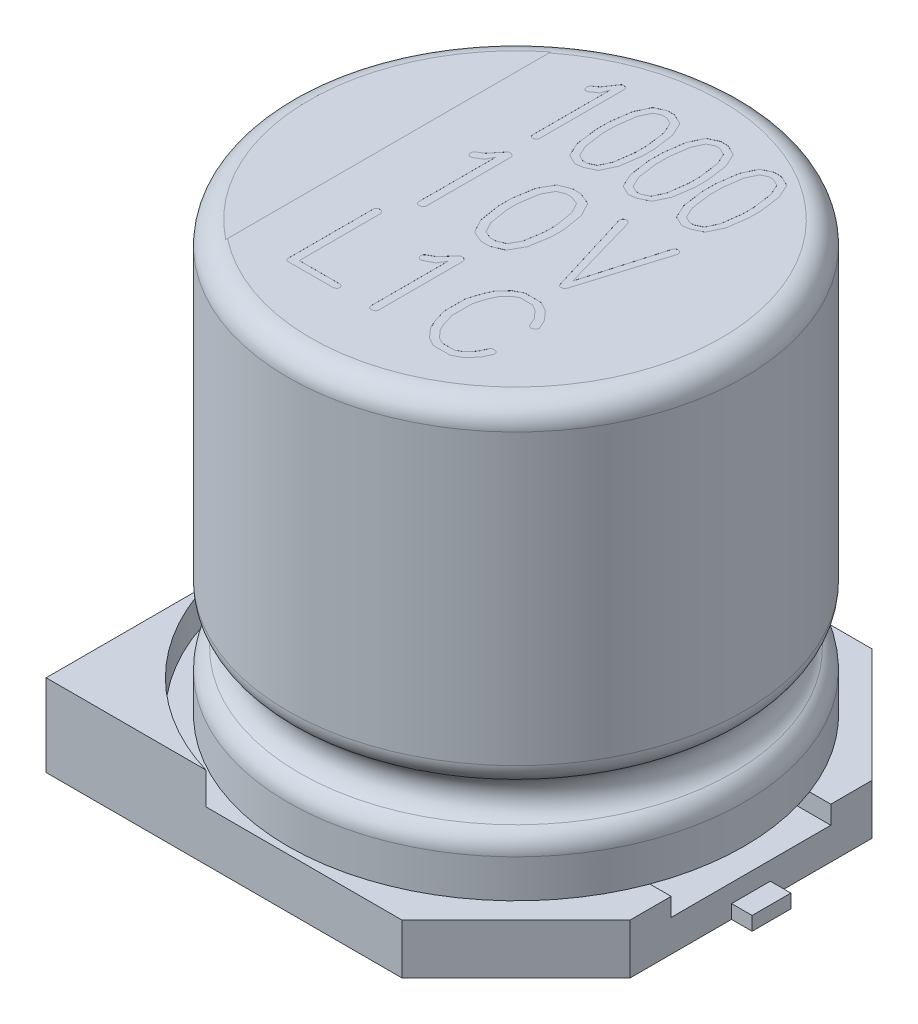
from build123d import *

# Parameters (mm, degrees)
BOSS_EXTRUDE1_DEPTH        = 1.1
BOSS_EXTRUDE2_DEPTH        = 0.7
CUT_EXTRUDE1_DEPTH         = 13.943734136
CUT_EXTRUDE1_DEPTH_BACK    = 13.943734136
SKETCH4_W                  = 3.5
SKETCH4_H                  = 0.4
BOSS_EXTRUDE3_DEPTH        = 0.001
BOSS_EXTRUDE3_DEPTH_BACK   = 0.3
SKETCH5_W                  = 3.35
SKETCH5_H                  = 0.85
BOSS_EXTRUDE3_2_DEPTH      = 0.001
BOSS_EXTRUDE3_2_DEPTH_BACK = 0.3
CUT_EXTRUDE2_DEPTH         = 13.967401474
CUT_EXTRUDE2_DEPTH_BACK    = 0.001
CUT_EXTRUDE3_START         = -0.001
CUT_EXTRUDE3_DEPTH         = 0.001


with BuildPart() as part:
    # Sketch1 → Revolve1 (revolve)
    with BuildSketch(Plane(origin=(0, 0, 0), x_dir=(0, 0, -1), z_dir=(1, 0, 0)), mode=Mode.PRIVATE) as revolve1_sk:
        with BuildLine():
            Line((0, 4.590029326), (5, 4.590029326))
            Line((5, 4.590029326), (5, -2.243945271))
            ThreePointArc((5, -2.243945271), (4.933012702, -2.493945271), (4.75, -2.676957973))
            ThreePointArc((4.75, -2.676957973), (4.5, -3.109970674), (4.75, -3.542983376))
            ThreePointArc((4.75, -3.542983376), (4.933012702, -3.725996078), (5, -3.975996078))
            Line((5, -3.975996078), (5, -4.809970674))
            Line((5, -4.809970674), (0, -4.809970674))
            Line((0, -4.809970674), (0, 4.590029326))
        make_face()
    revolve(revolve1_sk.sketch.rotate(Axis((0, 6.950146628, 0), (0, -1, 0)), 180), axis=Axis((0, 6.950146628, 0), (0, -1, 0)))

    # Sketch2 → Boss-Extrude1 (add)
    with BuildSketch(Plane.XZ.offset(4.809970674)):
        Polygon((2.65, 5.15), (5.15, 2.65), (5.15, -2.65), (2.65, -5.15), (-5.15, -5.15), (-5.15, 5.15), align=None)
    extrude(amount=BOSS_EXTRUDE1_DEPTH)

    # Sketch3 → Boss-Extrude2 (add)
    with BuildSketch(Plane(origin=(0, -4.809970674, 0), x_dir=(1, 0, 0), z_dir=(0, 1, 0))):
        with BuildLine():
            Line((-5.15, -5.15), (-1.65, -5.15))
            ThreePointArc((-1.65, -5.15), (-3.843149455, -3.843149455), (-5.15, -1.65))
            Line((-5.15, -1.65), (-5.15, -5.15))
        make_face()
        with BuildLine():
            Line((-5.15, 5.15), (-5.15, 1.65))
            ThreePointArc((-5.15, 1.65), (-3.843149455, 3.843149455), (-1.65, 5.15))
            Line((-1.65, 5.15), (-5.15, 5.15))
        make_face()
    extrude(amount=BOSS_EXTRUDE2_DEPTH)

    # Sketch4 → Cut-Extrude1 (cut, two sides: drawn at the far end of the back side and taken through both)
    with BuildSketch(Plane(origin=(5.15, 0, 0), x_dir=(0, 0, -1), z_dir=(1, 0, 0)).offset(-CUT_EXTRUDE1_DEPTH_BACK)):
        with Locations((0, -5.009970674)):
            Rectangle(SKETCH4_W, SKETCH4_H)
    extrude(amount=CUT_EXTRUDE1_DEPTH + CUT_EXTRUDE1_DEPTH_BACK, mode=Mode.SUBTRACT)

    # Sketch7 → Cut-Extrude2 (cut, two sides: drawn at the far end of the back side and taken through both)
    # profile 1 of 10: a face of its own
    with BuildSketch(Plane(origin=(0, 4.590029326, 0), x_dir=(1, 0, 0), z_dir=(0, 1, 0)).offset(-CUT_EXTRUDE2_DEPTH_BACK)):
        with BuildLine():
            Line((-1.287358611, 3.680722892), (-1.280204997, 3.653614458))
            Line((-1.280204997, 3.653614458), (-1.280581503, 1.788403614))
            add(Edge.make_bspline(
                [(-1.280581503, 1.788403614), (-1.282083709, 1.78059838), (-1.285026803, 1.765306502), (-1.300804669, 1.746576471), (-1.323002072, 1.732417863), (-1.341093541, 1.728206754), (-1.35098813, 1.725903614)],
                knots=[0, 0, 0, 0, 0.926923706, 1.816012601, 2.805533324, 4, 4, 4, 4], degree=3))
            add(Edge.make_bspline(
                [(-1.35098813, 1.725903614), (-1.359723833, 1.72627392), (-1.375804079, 1.72695556), (-1.397470416, 1.735232569), (-1.413162629, 1.75031976), (-1.418098667, 1.763278433), (-1.420641744, 1.769954819)],
                knots=[0, 0, 0, 0, 1.170207105, 2.154058829, 3.048959964, 4, 4, 4, 4], degree=3))
            Line((-1.420641744, 1.769954819), (-1.42478331, 1.786521084))
            Line((-1.42478331, 1.786521084), (-1.42478331, 3.485316265))
            Line((-1.42478331, 3.485316265), (-1.48540078, 3.319277108))
            Line((-1.48540078, 3.319277108), (-1.637509214, 3.214231928))
            add(Edge.make_bspline(
                [(-1.637509214, 3.214231928), (-1.643383153, 3.212719292), (-1.655400882, 3.209624528), (-1.667728225, 3.208188802), (-1.674030298, 3.207454819)],
                knots=[0, 0, 0, 0, 0.977545561, 2, 2, 2, 2], degree=3))
            add(Edge.make_bspline(
                [(-1.674030298, 3.207454819), (-1.678471766, 3.207710325), (-1.687104273, 3.20820693), (-1.699338984, 3.21318995), (-1.71043867, 3.220857322), (-1.723412192, 3.235214884), (-1.735972443, 3.258569338), (-1.737330004, 3.279679412), (-1.738036322, 3.290662651)],
                knots=[0, 0, 0, 0, 0.684472364, 1.330351367, 2.014823731, 2.757238248, 4.312842215, 6, 6, 6, 6], degree=3))
            add(Edge.make_bspline(
                [(-1.738036322, 3.290662651), (-1.737896608, 3.295067066), (-1.737627815, 3.303540598), (-1.73612328, 3.311882601), (-1.73540078, 3.315888554)],
                knots=[0, 0, 0, 0, 1.039570203, 2, 2, 2, 2], degree=3))
            add(Edge.make_bspline(
                [(-1.73540078, 3.315888554), (-1.732055146, 3.324876433), (-1.72603216, 3.341056883), (-1.713490769, 3.352825719), (-1.70791584, 3.358057229)],
                knots=[0, 0, 0, 0, 1.110955416, 2, 2, 2, 2], degree=3))
            Line((-1.70791584, 3.358057229), (-1.594211021, 3.439759036))
            Line((-1.594211021, 3.439759036), (-1.411605599, 3.704066265))
            add(Edge.make_bspline(
                [(-1.411605599, 3.704066265), (-1.409112114, 3.707328687), (-1.404159295, 3.713808849), (-1.394192911, 3.721323412), (-1.381957633, 3.724899665), (-1.373470268, 3.725560341), (-1.369060419, 3.725903614)],
                knots=[0, 0, 0, 0, 0.984513404, 1.95554287, 2.937744663, 4, 4, 4, 4], degree=3))
            add(Edge.make_bspline(
                [(-1.369060419, 3.725903614), (-1.361062154, 3.72547855), (-1.345191019, 3.724635084), (-1.322994282, 3.715329488), (-1.302817886, 3.701003687), (-1.292677955, 3.68770126), (-1.287358611, 3.680722892)],
                knots=[0, 0, 0, 0, 0.981550807, 1.947712958, 2.923383228, 4, 4, 4, 4], degree=3))
        make_face()
    # profile 2 of 10: a face of its own
    with BuildSketch(Plane(origin=(0, 4.590029326, 0), x_dir=(1, 0, 0), z_dir=(0, 1, 0)).offset(-CUT_EXTRUDE2_DEPTH_BACK)):
        with BuildLine():
            add(Edge.make_bspline(
                [(-0.248051383, 3.72251506), (-0.24203034, 3.719496974), (-0.229135091, 3.713033147), (-0.208595148, 3.702902732), (-0.18527564, 3.691944253), (-0.159558959, 3.679621723), (-0.131158222, 3.665881803), (-0.100055538, 3.651416772), (-0.066480613, 3.635477098), (-0.043237923, 3.624611149), (-0.031183913, 3.618975904)],
                knots=[0, 0, 0, 0, 0.672609136, 1.440525024, 2.287058542, 3.245674053, 4.288353812, 5.437736142, 6.671171322, 8, 8, 8, 8], degree=3))
            Line((-0.031183913, 3.618975904), (-0.011982105, 3.59186747))
            Line((-0.011982105, 3.59186747), (0.111888377, 3.325301205))
            Line((0.111888377, 3.325301205), (0.118288979, 3.301204819))
            Line((0.118288979, 3.301204819), (0.180035967, 2.854292169))
            Line((0.180035967, 2.854292169), (0.180035967, 2.583960843))
            Line((0.180035967, 2.583960843), (0.116406449, 2.130271084))
            Line((0.116406449, 2.130271084), (0.111135364, 2.123493976))
            Line((0.111135364, 2.123493976), (-0.02478331, 1.839608434))
            Line((-0.02478331, 1.839608434), (-0.036831503, 1.827560241))
            add(Edge.make_bspline(
                [(-0.036831503, 1.827560241), (-0.044261402, 1.82460761), (-0.060515075, 1.818148424), (-0.086099536, 1.806375553), (-0.11527551, 1.792820958), (-0.146245318, 1.777689353), (-0.176463601, 1.762188932), (-0.20401506, 1.749408073), (-0.226578799, 1.737927848), (-0.240141144, 1.731167327), (-0.246168852, 1.728162651)],
                knots=[0, 0, 0, 0, 0.827651576, 1.81057338, 2.915068925, 4.158703476, 5.379039228, 6.43099689, 7.302665284, 8, 8, 8, 8], degree=3))
            Line((-0.246168852, 1.728162651), (-0.412961021, 1.701807229))
            add(Edge.make_bspline(
                [(-0.412961021, 1.701807229), (-0.426549241, 1.70775713), (-0.456286547, 1.720778263), (-0.504097963, 1.74380585), (-0.559791458, 1.770206799), (-0.599121465, 1.789950838), (-0.620039334, 1.800451807)],
                knots=[0, 0, 0, 0, 0.775902592, 1.698033599, 2.775687197, 4, 4, 4, 4], degree=3))
            Line((-0.620039334, 1.800451807), (-0.63848813, 1.822665663))
            Line((-0.63848813, 1.822665663), (-0.765747166, 2.102033133))
            Line((-0.765747166, 2.102033133), (-0.770641744, 2.122364458))
            Line((-0.770641744, 2.122364458), (-0.832012226, 2.574171687))
            Line((-0.832012226, 2.574171687), (-0.832012226, 2.864457831))
            Line((-0.832012226, 2.864457831), (-0.770265238, 3.315135542))
            Line((-0.770265238, 3.315135542), (-0.764241142, 3.333207831))
            Line((-0.764241142, 3.333207831), (-0.634346563, 3.607304217))
            Line((-0.634346563, 3.607304217), (-0.617403792, 3.627635542))
            add(Edge.make_bspline(
                [(-0.617403792, 3.627635542), (-0.610497497, 3.630513019), (-0.595392183, 3.636806582), (-0.570938493, 3.647242334), (-0.543026252, 3.660221362), (-0.512637146, 3.674620918), (-0.482230621, 3.689753482), (-0.453839522, 3.702988578), (-0.429046657, 3.71490436), (-0.413717575, 3.722145988), (-0.406560419, 3.725527108)],
                knots=[0, 0, 0, 0, 0.772324666, 1.689213553, 2.744240256, 3.949553191, 5.160492455, 6.249955038, 7.182903063, 8, 8, 8, 8], degree=3))
            Line((-0.406560419, 3.725527108), (-0.248051383, 3.72251506))
        make_face()
        Polygon((-0.133593551, 3.510542169), (-0.283066443, 3.581325301), (-0.382840539, 3.581325301), (-0.520641744, 3.515060241), (-0.629075479, 3.282379518), (-0.687433913, 2.857680723), (-0.687433913, 2.581325301), (-0.627569455, 2.149849398), (-0.518006202, 1.912274096), (-0.383217045, 1.846385542), (-0.284948973, 1.846385542), (-0.131711021, 1.921686747), (-0.022524274, 2.155873494), (0.035457654, 2.580948795), (0.035457654, 2.835090361), (-0.02478331, 3.27560241), align=None, mode=Mode.SUBTRACT)
    # profile 3 of 10: a face of its own
    with BuildSketch(Plane(origin=(0, 4.590029326, 0), x_dir=(1, 0, 0), z_dir=(0, 1, 0)).offset(-CUT_EXTRUDE2_DEPTH_BACK)):
        with BuildLine():
            add(Edge.make_bspline(
                [(0.923032955, 3.72251506), (0.929053997, 3.719496974), (0.941949246, 3.713033147), (0.962489189, 3.702902732), (0.985808697, 3.691944253), (1.011525379, 3.679621723), (1.039926115, 3.665881803), (1.071028799, 3.651416772), (1.104603724, 3.635477098), (1.127846415, 3.624611149), (1.139900425, 3.618975904)],
                knots=[0, 0, 0, 0, 0.672609136, 1.440525024, 2.287058542, 3.245674053, 4.288353812, 5.437736142, 6.671171322, 8, 8, 8, 8], degree=3))
            Line((1.139900425, 3.618975904), (1.159102232, 3.59186747))
            Line((1.159102232, 3.59186747), (1.282972714, 3.325301205))
            Line((1.282972714, 3.325301205), (1.289373316, 3.301204819))
            Line((1.289373316, 3.301204819), (1.351120304, 2.854292169))
            Line((1.351120304, 2.854292169), (1.351120304, 2.583960843))
            Line((1.351120304, 2.583960843), (1.287490786, 2.130271084))
            Line((1.287490786, 2.130271084), (1.282219702, 2.123493976))
            Line((1.282219702, 2.123493976), (1.146301027, 1.839608434))
            Line((1.146301027, 1.839608434), (1.134252834, 1.827560241))
            add(Edge.make_bspline(
                [(1.134252834, 1.827560241), (1.126822935, 1.82460761), (1.110569262, 1.818148424), (1.084984801, 1.806375553), (1.055808827, 1.792820958), (1.024839019, 1.777689353), (0.994620736, 1.762188932), (0.967069278, 1.749408073), (0.944505539, 1.737927848), (0.930943194, 1.731167327), (0.924915485, 1.728162651)],
                knots=[0, 0, 0, 0, 0.827651576, 1.81057338, 2.915068925, 4.158703476, 5.379039228, 6.43099689, 7.302665284, 8, 8, 8, 8], degree=3))
            Line((0.924915485, 1.728162651), (0.758123316, 1.701807229))
            add(Edge.make_bspline(
                [(0.758123316, 1.701807229), (0.744535097, 1.70775713), (0.71479779, 1.720778263), (0.666986374, 1.74380585), (0.61129288, 1.770206799), (0.571962872, 1.789950838), (0.551045003, 1.800451807)],
                knots=[0, 0, 0, 0, 0.775902592, 1.698033599, 2.775687197, 4, 4, 4, 4], degree=3))
            Line((0.551045003, 1.800451807), (0.532596208, 1.822665663))
            Line((0.532596208, 1.822665663), (0.405337172, 2.102033133))
            Line((0.405337172, 2.102033133), (0.400442593, 2.122364458))
            Line((0.400442593, 2.122364458), (0.339072111, 2.574171687))
            Line((0.339072111, 2.574171687), (0.339072111, 2.864457831))
            Line((0.339072111, 2.864457831), (0.400819099, 3.315135542))
            Line((0.400819099, 3.315135542), (0.406843196, 3.333207831))
            Line((0.406843196, 3.333207831), (0.536737774, 3.607304217))
            Line((0.536737774, 3.607304217), (0.553680545, 3.627635542))
            add(Edge.make_bspline(
                [(0.553680545, 3.627635542), (0.56058684, 3.630513019), (0.575692155, 3.636806582), (0.600145845, 3.647242334), (0.628058085, 3.660221362), (0.658447191, 3.674620918), (0.688853716, 3.689753482), (0.717244816, 3.702988578), (0.74203768, 3.71490436), (0.757366762, 3.722145988), (0.764523919, 3.725527108)],
                knots=[0, 0, 0, 0, 0.772324666, 1.689213553, 2.744240256, 3.949553191, 5.160492455, 6.249955038, 7.182903063, 8, 8, 8, 8], degree=3))
            Line((0.764523919, 3.725527108), (0.923032955, 3.72251506))
        make_face()
        Polygon((1.037490786, 3.510542169), (0.888017895, 3.581325301), (0.788243798, 3.581325301), (0.650442593, 3.515060241), (0.542008858, 3.282379518), (0.483650425, 2.857680723), (0.483650425, 2.581325301), (0.543514883, 2.149849398), (0.653078136, 1.912274096), (0.787867292, 1.846385542), (0.886135364, 1.846385542), (1.039373316, 1.921686747), (1.148560063, 2.155873494), (1.206541991, 2.580948795), (1.206541991, 2.835090361), (1.146301027, 3.27560241), align=None, mode=Mode.SUBTRACT)
    # profile 4 of 10: a face of its own
    with BuildSketch(Plane(origin=(0, 4.590029326, 0), x_dir=(1, 0, 0), z_dir=(0, 1, 0)).offset(-CUT_EXTRUDE2_DEPTH_BACK)):
        with BuildLine():
            add(Edge.make_bspline(
                [(2.094117292, 3.72251506), (2.100138335, 3.719496974), (2.113033584, 3.713033147), (2.133573526, 3.702902732), (2.156893035, 3.691944253), (2.182609716, 3.679621723), (2.211010453, 3.665881803), (2.242113136, 3.651416772), (2.275688062, 3.635477098), (2.298930752, 3.624611149), (2.310984762, 3.618975904)],
                knots=[0, 0, 0, 0, 0.672609136, 1.440525024, 2.287058542, 3.245674053, 4.288353812, 5.437736142, 6.671171322, 8, 8, 8, 8], degree=3))
            Line((2.310984762, 3.618975904), (2.330186569, 3.59186747))
            Line((2.330186569, 3.59186747), (2.454057051, 3.325301205))
            Line((2.454057051, 3.325301205), (2.460457654, 3.301204819))
            Line((2.460457654, 3.301204819), (2.522204642, 2.854292169))
            Line((2.522204642, 2.854292169), (2.522204642, 2.583960843))
            Line((2.522204642, 2.583960843), (2.458575123, 2.130271084))
            Line((2.458575123, 2.130271084), (2.453304039, 2.123493976))
            Line((2.453304039, 2.123493976), (2.317385364, 1.839608434))
            Line((2.317385364, 1.839608434), (2.305337172, 1.827560241))
            add(Edge.make_bspline(
                [(2.305337172, 1.827560241), (2.297907272, 1.82460761), (2.2816536, 1.818148424), (2.256069139, 1.806375553), (2.226893164, 1.792820958), (2.195923357, 1.777689353), (2.165705073, 1.762188932), (2.138153615, 1.749408073), (2.115589876, 1.737927848), (2.102027531, 1.731167327), (2.095999822, 1.728162651)],
                knots=[0, 0, 0, 0, 0.827651576, 1.81057338, 2.915068925, 4.158703476, 5.379039228, 6.43099689, 7.302665284, 8, 8, 8, 8], degree=3))
            Line((2.095999822, 1.728162651), (1.929207654, 1.701807229))
            add(Edge.make_bspline(
                [(1.929207654, 1.701807229), (1.915619434, 1.70775713), (1.885882128, 1.720778263), (1.838070711, 1.74380585), (1.782377217, 1.770206799), (1.743047209, 1.789950838), (1.72212934, 1.800451807)],
                knots=[0, 0, 0, 0, 0.775902592, 1.698033599, 2.775687197, 4, 4, 4, 4], degree=3))
            Line((1.72212934, 1.800451807), (1.703680545, 1.822665663))
            Line((1.703680545, 1.822665663), (1.576421509, 2.102033133))
            Line((1.576421509, 2.102033133), (1.571526931, 2.122364458))
            Line((1.571526931, 2.122364458), (1.510156449, 2.574171687))
            Line((1.510156449, 2.574171687), (1.510156449, 2.864457831))
            Line((1.510156449, 2.864457831), (1.571903437, 3.315135542))
            Line((1.571903437, 3.315135542), (1.577927533, 3.333207831))
            Line((1.577927533, 3.333207831), (1.707822111, 3.607304217))
            Line((1.707822111, 3.607304217), (1.724764883, 3.627635542))
            add(Edge.make_bspline(
                [(1.724764883, 3.627635542), (1.731671177, 3.630513019), (1.746776492, 3.636806582), (1.771230182, 3.647242334), (1.799142422, 3.660221362), (1.829531529, 3.674620918), (1.859938054, 3.689753482), (1.888329153, 3.702988578), (1.913122017, 3.71490436), (1.928451099, 3.722145988), (1.935608256, 3.725527108)],
                knots=[0, 0, 0, 0, 0.772324666, 1.689213553, 2.744240256, 3.949553191, 5.160492455, 6.249955038, 7.182903063, 8, 8, 8, 8], degree=3))
            Line((1.935608256, 3.725527108), (2.094117292, 3.72251506))
        make_face()
        Polygon((2.208575123, 3.510542169), (2.059102232, 3.581325301), (1.959328136, 3.581325301), (1.821526931, 3.515060241), (1.713093196, 3.282379518), (1.654734762, 2.857680723), (1.654734762, 2.581325301), (1.71459922, 2.149849398), (1.824162473, 1.912274096), (1.95895163, 1.846385542), (2.057219702, 1.846385542), (2.210457654, 1.921686747), (2.319644401, 2.155873494), (2.377626328, 2.580948795), (2.377626328, 2.835090361), (2.317385364, 3.27560241), align=None, mode=Mode.SUBTRACT)
    # profile 5 of 10: a face of its own
    with BuildSketch(Plane(origin=(0, 4.590029326, 0), x_dir=(1, 0, 0), z_dir=(0, 1, 0)).offset(-CUT_EXTRUDE2_DEPTH_BACK)):
        with BuildLine():
            Line((-1.245104775, 1.156622024), (-1.238036322, 1.133556548))
            Line((-1.238036322, 1.133556548), (-1.238408346, -0.735863095))
            add(Edge.make_bspline(
                [(-1.238408346, -0.735863095), (-1.240232416, -0.743863942), (-1.243842331, -0.759697981), (-1.261642445, -0.778827002), (-1.286949888, -0.791795773), (-1.306816525, -0.795564198), (-1.317649418, -0.797619048)],
                knots=[0, 0, 0, 0, 0.894623444, 1.770500318, 2.784296937, 4, 4, 4, 4], degree=3))
            add(Edge.make_bspline(
                [(-1.317649418, -0.797619048), (-1.327759081, -0.797233266), (-1.346126371, -0.796532375), (-1.3708586, -0.788890132), (-1.38959564, -0.774993641), (-1.395974132, -0.761996098), (-1.399122632, -0.755580357)],
                knots=[0, 0, 0, 0, 1.236245911, 2.246018165, 3.134213831, 4, 4, 4, 4], degree=3))
            Line((-1.399122632, -0.755580357), (-1.404702989, -0.738467262))
            Line((-1.404702989, -0.738467262), (-1.404702989, 0.964657738))
            Line((-1.404702989, 0.964657738), (-1.485432156, 0.799479167))
            Line((-1.485432156, 0.799479167), (-1.657307156, 0.696056548))
            add(Edge.make_bspline(
                [(-1.657307156, 0.696056548), (-1.662874288, 0.694862614), (-1.674566155, 0.692355164), (-1.686433014, 0.690877982), (-1.692649418, 0.690104167)],
                knots=[0, 0, 0, 0, 0.952308529, 2, 2, 2, 2], degree=3))
            add(Edge.make_bspline(
                [(-1.692649418, 0.690104167), (-1.697156576, 0.690377075), (-1.706150233, 0.690921642), (-1.718998937, 0.695784149), (-1.731154164, 0.702858803), (-1.741942648, 0.713022949), (-1.75067414, 0.725493229), (-1.757134298, 0.739746203), (-1.761457526, 0.75545157), (-1.761713847, 0.766586967), (-1.761845846, 0.772321429)],
                knots=[0, 0, 0, 0, 0.902813073, 1.801487944, 2.72907741, 3.716676652, 4.753977817, 5.768877659, 6.851025504, 8, 8, 8, 8], degree=3))
            add(Edge.make_bspline(
                [(-1.761845846, 0.772321429), (-1.761577746, 0.776799185), (-1.761053416, 0.785556446), (-1.759336604, 0.79415913), (-1.758497632, 0.798363095)],
                knots=[0, 0, 0, 0, 1.022638749, 2, 2, 2, 2], degree=3))
            add(Edge.make_bspline(
                [(-1.758497632, 0.798363095), (-1.754441279, 0.807314482), (-1.746994176, 0.823748432), (-1.732914308, 0.834935956), (-1.726503584, 0.840029762)],
                knots=[0, 0, 0, 0, 1.08937731, 2, 2, 2, 2], degree=3))
            Line((-1.726503584, 0.840029762), (-1.59331906, 0.920386905))
            Line((-1.59331906, 0.920386905), (-1.378289298, 1.18266369))
            add(Edge.make_bspline(
                [(-1.378289298, 1.18266369), (-1.375434427, 1.185658576), (-1.369766324, 1.191604663), (-1.359055454, 1.198026477), (-1.346805765, 1.201900297), (-1.338140648, 1.202216798), (-1.333646441, 1.202380952)],
                knots=[0, 0, 0, 0, 0.98022139, 1.946145258, 2.934757973, 4, 4, 4, 4], degree=3))
            add(Edge.make_bspline(
                [(-1.333646441, 1.202380952), (-1.325382866, 1.201794041), (-1.308899768, 1.200623348), (-1.285332721, 1.191513759), (-1.26338431, 1.176982187), (-1.251396361, 1.163629736), (-1.245104775, 1.156622024)],
                knots=[0, 0, 0, 0, 0.960804293, 1.916486586, 2.906518233, 4, 4, 4, 4], degree=3))
        make_face()
    # profile 6 of 10: a face of its own
    with BuildSketch(Plane(origin=(0, 4.590029326, 0), x_dir=(1, 0, 0), z_dir=(0, 1, 0)).offset(-CUT_EXTRUDE2_DEPTH_BACK)):
        with BuildLine():
            add(Edge.make_bspline(
                [(0.221189868, 1.199032738), (0.228000269, 1.196033053), (0.242694002, 1.189561102), (0.266358948, 1.179759639), (0.292838885, 1.168282376), (0.322618622, 1.156777975), (0.354965164, 1.143158677), (0.390331457, 1.128522429), (0.429010864, 1.113612528), (0.455584682, 1.102728091), (0.469329749, 1.097098214)],
                knots=[0, 0, 0, 0, 0.665720275, 1.436320058, 2.291406459, 3.247277281, 4.291804095, 5.431067394, 6.671242782, 8, 8, 8, 8], degree=3))
            Line((0.469329749, 1.097098214), (0.493511297, 1.068080357))
            Line((0.493511297, 1.068080357), (0.636740463, 0.802827381))
            Line((0.636740463, 0.802827381), (0.644924987, 0.774925595))
            Line((0.644924987, 0.774925595), (0.716725582, 0.333333333))
            Line((0.716725582, 0.333333333), (0.716725582, 0.058407738))
            Line((0.716725582, 0.058407738), (0.642320821, -0.393973214))
            Line((0.642320821, -0.393973214), (0.63636844, -0.402157738))
            Line((0.63636844, -0.402157738), (0.477886297, -0.685267857))
            Line((0.477886297, -0.685267857), (0.463377368, -0.697544643))
            add(Edge.make_bspline(
                [(0.463377368, -0.697544643), (0.454421412, -0.700569997), (0.43538385, -0.707000955), (0.405549375, -0.718901145), (0.372130739, -0.732141295), (0.336721639, -0.746920367), (0.301729832, -0.761627978), (0.270107045, -0.775432928), (0.242665453, -0.786843473), (0.226136817, -0.794239959), (0.218585702, -0.797619048)],
                knots=[0, 0, 0, 0, 0.857514317, 1.822807192, 2.913398912, 4.118988428, 5.303819582, 6.357154914, 7.249465436, 8, 8, 8, 8], degree=3))
            Line((0.218585702, -0.797619048), (0.031829749, -0.797619048))
            add(Edge.make_bspline(
                [(0.031829749, -0.797619048), (0.016792704, -0.791870623), (-0.016422532, -0.779172963), (-0.070313291, -0.756349969), (-0.133885042, -0.730302769), (-0.179137427, -0.7108846), (-0.203289298, -0.700520833)],
                knots=[0, 0, 0, 0, 0.759314602, 1.677245352, 2.760311232, 4, 4, 4, 4], degree=3))
            Line((-0.203289298, -0.700520833), (-0.224122632, -0.679315476))
            Line((-0.224122632, -0.679315476), (-0.372560132, -0.40327381))
            Line((-0.372560132, -0.40327381), (-0.378140489, -0.3828125))
            Line((-0.378140489, -0.3828125), (-0.449941084, 0.0625))
            Line((-0.449941084, 0.0625), (-0.449941084, 0.351934524))
            Line((-0.449941084, 0.351934524), (-0.377396441, 0.797247024))
            Line((-0.377396441, 0.797247024), (-0.369955965, 0.816592262))
            Line((-0.369955965, 0.816592262), (-0.219286322, 1.087053571))
            Line((-0.219286322, 1.087053571), (-0.19956906, 1.10639881))
            add(Edge.make_bspline(
                [(-0.19956906, 1.10639881), (-0.191731681, 1.109059584), (-0.174450164, 1.114926625), (-0.146832701, 1.126108612), (-0.114190312, 1.138040132), (-0.078960225, 1.152478606), (-0.043711853, 1.16739438), (-0.010956452, 1.180010673), (0.017023607, 1.191836554), (0.034301701, 1.19880482), (0.042246416, 1.202008929)],
                knots=[0, 0, 0, 0, 0.76366452, 1.683889708, 2.748731425, 3.970665397, 5.196932387, 6.280730219, 7.209455205, 8, 8, 8, 8], degree=3))
            Line((0.042246416, 1.202008929), (0.221189868, 1.199032738))
        make_face()
        Polygon((0.358466654, 0.966889881), (0.184731535, 1.035714286), (0.066799987, 1.035714286), (-0.093914298, 0.970238095), (-0.216682156, 0.747767857), (-0.283274418, 0.338169643), (-0.283274418, 0.076636905), (-0.214450013, -0.341145833), (-0.091682156, -0.565848214), (0.066427963, -0.630952381), (0.183615463, -0.630952381), (0.360698797, -0.556919643), (0.483838678, -0.334077381), (0.550058916, 0.076636905), (0.550058916, 0.318080357), (0.481606535, 0.741071429), align=None, mode=Mode.SUBTRACT)
    # profile 7 of 10: a face of its own
    with BuildSketch(Plane(origin=(0, 4.590029326, 0), x_dir=(1, 0, 0), z_dir=(0, 1, 0)).offset(-CUT_EXTRUDE2_DEPTH_BACK)):
        with BuildLine():
            Line((1.301323797, 1.15327381), (1.789791059, -0.545386905))
            Line((1.789791059, -0.545386905), (2.282722606, 1.161458333))
            add(Edge.make_bspline(
                [(2.282722606, 1.161458333), (2.286357292, 1.166601162), (2.293560059, 1.176792578), (2.308105525, 1.188886051), (2.325305438, 1.197669065), (2.337943292, 1.200774879), (2.344478559, 1.202380952)],
                knots=[0, 0, 0, 0, 0.987716808, 1.957333834, 2.943699851, 4, 4, 4, 4], degree=3))
            add(Edge.make_bspline(
                [(2.344478559, 1.202380952), (2.354501203, 1.200237705), (2.373014436, 1.196278825), (2.397434184, 1.185924101), (2.416519124, 1.17217667), (2.424166204, 1.159880136), (2.427811892, 1.154017857)],
                knots=[0, 0, 0, 0, 1.230125372, 2.272214417, 3.17629134, 4, 4, 4, 4], degree=3))
            add(Edge.make_bspline(
                [(2.427811892, 1.154017857), (2.429218066, 1.147840087), (2.432504563, 1.133401466), (2.4330692, 1.118592046), (2.433392249, 1.110119048)],
                knots=[0, 0, 0, 0, 0.855728484, 2, 2, 2, 2], degree=3))
            Line((2.433392249, 1.110119048), (1.863079749, -0.756324405))
            add(Edge.make_bspline(
                [(1.863079749, -0.756324405), (1.859030636, -0.762786939), (1.850954926, -0.775676073), (1.830482838, -0.788686834), (1.805245766, -0.796479472), (1.786513442, -0.797219462), (1.776398202, -0.797619048)],
                knots=[0, 0, 0, 0, 0.894720018, 1.784464948, 2.803636489, 4, 4, 4, 4], degree=3))
            add(Edge.make_bspline(
                [(1.776398202, -0.797619048), (1.769306399, -0.797036003), (1.755607833, -0.795909791), (1.737319828, -0.785144837), (1.722913946, -0.768337221), (1.717769163, -0.753971963), (1.715014273, -0.746279762)],
                knots=[0, 0, 0, 0, 0.979272317, 1.891568073, 2.870992581, 4, 4, 4, 4], degree=3))
            Line((1.715014273, -0.746279762), (1.147677963, 1.104910714))
            add(Edge.make_bspline(
                [(1.147677963, 1.104910714), (1.147687028, 1.112128994), (1.147703846, 1.125522545), (1.151190596, 1.143942019), (1.154531039, 1.159997665), (1.159496762, 1.16885587), (1.161814868, 1.172991071)],
                knots=[0, 0, 0, 0, 1.227509019, 2.277648804, 3.195969407, 4, 4, 4, 4], degree=3))
            add(Edge.make_bspline(
                [(1.161814868, 1.172991071), (1.166508009, 1.17751346), (1.175150933, 1.185841925), (1.189332046, 1.194934438), (1.202743118, 1.201128691), (1.211859897, 1.201981488), (1.216130344, 1.202380952)],
                knots=[0, 0, 0, 0, 1.233937754, 2.272428876, 3.190777528, 4, 4, 4, 4], degree=3))
            add(Edge.make_bspline(
                [(1.216130344, 1.202380952), (1.224077092, 1.201602469), (1.24122079, 1.19992303), (1.264680767, 1.187440745), (1.286857888, 1.173300402), (1.296794078, 1.159544748), (1.301323797, 1.15327381)],
                knots=[0, 0, 0, 0, 0.933686637, 2.014263215, 3.094740652, 4, 4, 4, 4], degree=3))
        make_face()
    # profile 8 of 10: a face of its own
    with BuildSketch(Plane(origin=(0, 4.590029326, 0), x_dir=(1, 0, 0), z_dir=(0, 1, 0)).offset(-CUT_EXTRUDE2_DEPTH_BACK)):
        with BuildLine():
            Line((-1.597783346, -1.353050595), (-1.595179179, -1.37202381))
            Line((-1.595179179, -1.37202381), (-1.595179179, -3.154761905))
            Line((-1.595179179, -3.154761905), (-0.71831906, -3.155133929))
            add(Edge.make_bspline(
                [(-0.71831906, -3.155133929), (-0.706997395, -3.157035279), (-0.686284086, -3.160513853), (-0.65973083, -3.173431937), (-0.64112137, -3.193064898), (-0.637049439, -3.209370181), (-0.634985727, -3.217633929)],
                knots=[0, 0, 0, 0, 1.220300133, 2.232573956, 3.104243569, 4, 4, 4, 4], degree=3))
            add(Edge.make_bspline(
                [(-0.634985727, -3.217633929), (-0.63560318, -3.225318569), (-0.636811784, -3.240360515), (-0.647411816, -3.261226215), (-0.664539351, -3.278785037), (-0.679244063, -3.287192631), (-0.68706906, -3.291666667)],
                knots=[0, 0, 0, 0, 0.960624189, 1.880329837, 2.8720341, 4, 4, 4, 4], degree=3))
            Line((-0.68706906, -3.291666667), (-0.712738703, -3.297619048))
            Line((-0.712738703, -3.297619048), (-1.707902394, -3.297619048))
            add(Edge.make_bspline(
                [(-1.707902394, -3.297619048), (-1.715098808, -3.295235837), (-1.729038517, -3.290619474), (-1.745582071, -3.275876065), (-1.757520911, -3.256792382), (-1.760353092, -3.241868754), (-1.761845846, -3.234002976)],
                knots=[0, 0, 0, 0, 1.014260557, 1.964658675, 2.927235296, 4, 4, 4, 4], degree=3))
            Line((-1.761845846, -3.234002976), (-1.761845846, -1.354910714))
            add(Edge.make_bspline(
                [(-1.761845846, -1.354910714), (-1.759259558, -1.347410478), (-1.754326272, -1.333103947), (-1.740941571, -1.315187299), (-1.722755878, -1.302929439), (-1.708810879, -1.299432707), (-1.701577989, -1.297619048)],
                knots=[0, 0, 0, 0, 1.076188992, 2.052805991, 2.990043777, 4, 4, 4, 4], degree=3))
            add(Edge.make_bspline(
                [(-1.701577989, -1.297619048), (-1.690319729, -1.29814989), (-1.668863201, -1.299161595), (-1.639170818, -1.309919448), (-1.614445276, -1.327935812), (-1.603401743, -1.344581899), (-1.597783346, -1.353050595)],
                knots=[0, 0, 0, 0, 1.088492209, 2.07450024, 3.020402102, 4, 4, 4, 4], degree=3))
        make_face()
    # profile 9 of 10: a face of its own
    with BuildSketch(Plane(origin=(0, 4.590029326, 0), x_dir=(1, 0, 0), z_dir=(0, 1, 0)).offset(-CUT_EXTRUDE2_DEPTH_BACK)):
        with BuildLine():
            Line((0.205416059, -1.34077381), (0.21434463, -1.367559524))
            Line((0.21434463, -1.367559524), (0.213972606, -3.235863095))
            add(Edge.make_bspline(
                [(0.213972606, -3.235863095), (0.212148537, -3.243863942), (0.208538621, -3.259697981), (0.190738507, -3.278827002), (0.165431064, -3.291795773), (0.145564428, -3.295564198), (0.134731535, -3.297619048)],
                knots=[0, 0, 0, 0, 0.894623444, 1.770500318, 2.784296937, 4, 4, 4, 4], degree=3))
            add(Edge.make_bspline(
                [(0.134731535, -3.297619048), (0.124621872, -3.297233266), (0.106254581, -3.296532375), (0.081522352, -3.288890132), (0.062785313, -3.274993641), (0.05640682, -3.261996098), (0.053258321, -3.255580357)],
                knots=[0, 0, 0, 0, 1.236245911, 2.246018165, 3.134213831, 4, 4, 4, 4], degree=3))
            Line((0.053258321, -3.255580357), (0.047677963, -3.238467262))
            Line((0.047677963, -3.238467262), (0.047677963, -1.535342262))
            Line((0.047677963, -1.535342262), (-0.053884537, -1.702008929))
            Line((-0.053884537, -1.702008929), (-0.247708941, -1.8046875))
            add(Edge.make_bspline(
                [(-0.247708941, -1.8046875), (-0.253145286, -1.805933492), (-0.264423324, -1.80851838), (-0.275959652, -1.809425811), (-0.281935132, -1.809895833)],
                knots=[0, 0, 0, 0, 0.964058555, 2, 2, 2, 2], degree=3))
            add(Edge.make_bspline(
                [(-0.281935132, -1.809895833), (-0.286800896, -1.809595438), (-0.29633862, -1.809006612), (-0.310198748, -1.804721361), (-0.323061594, -1.797429244), (-0.334764758, -1.787448911), (-0.344958313, -1.775292774), (-0.352053526, -1.760866578), (-0.35624165, -1.744776568), (-0.356795528, -1.733533188), (-0.357083941, -1.727678571)],
                knots=[0, 0, 0, 0, 0.940792671, 1.844113277, 2.778764939, 3.783491654, 4.806676104, 5.826195741, 6.868063668, 8, 8, 8, 8], degree=3))
            add(Edge.make_bspline(
                [(-0.357083941, -1.727678571), (-0.356808966, -1.723201947), (-0.356263691, -1.714324814), (-0.354573551, -1.705593236), (-0.353735727, -1.701264881)],
                knots=[0, 0, 0, 0, 1.008574286, 2, 2, 2, 2], degree=3))
            add(Edge.make_bspline(
                [(-0.353735727, -1.701264881), (-0.34920176, -1.692125931), (-0.340801399, -1.675193633), (-0.325456287, -1.664259015), (-0.318393465, -1.65922619)],
                knots=[0, 0, 0, 0, 1.07946945, 2, 2, 2, 2], degree=3))
            Line((-0.318393465, -1.65922619), (-0.169955965, -1.578125))
            Line((-0.169955965, -1.578125), (0.067023202, -1.316592262))
            add(Edge.make_bspline(
                [(0.067023202, -1.316592262), (0.069998138, -1.313693739), (0.076010397, -1.307835909), (0.087424219, -1.30213352), (0.100100155, -1.298023208), (0.109147795, -1.297758192), (0.113898202, -1.297619048)],
                knots=[0, 0, 0, 0, 0.952143839, 1.924254498, 2.910142805, 4, 4, 4, 4], degree=3))
            add(Edge.make_bspline(
                [(0.113898202, -1.297619048), (0.122413078, -1.298052542), (0.139239979, -1.298909203), (0.163318266, -1.307937892), (0.186198502, -1.321240219), (0.198863583, -1.334113578), (0.205416059, -1.34077381)],
                knots=[0, 0, 0, 0, 0.976324135, 1.929389051, 2.928737262, 4, 4, 4, 4], degree=3))
        make_face()
    # profile 10 of 10: a face of its own
    with BuildSketch(Plane(origin=(0, 4.590029326, 0), x_dir=(1, 0, 0), z_dir=(0, 1, 0)).offset(-CUT_EXTRUDE2_DEPTH_BACK)):
        with BuildLine():
            Line((2.050654154, -1.407738095), (2.229597606, -1.607886905))
            Line((2.229597606, -1.607886905), (2.320371416, -1.80766369))
            add(Edge.make_bspline(
                [(2.320371416, -1.80766369), (2.319896548, -1.814939629), (2.318968818, -1.829154326), (2.310728451, -1.849275968), (2.298529414, -1.868037355), (2.286701605, -1.877765271), (2.280564868, -1.8828125)],
                knots=[0, 0, 0, 0, 0.986368215, 1.927026276, 2.92445906, 4, 4, 4, 4], degree=3))
            add(Edge.make_bspline(
                [(2.280564868, -1.8828125), (2.27363956, -1.884992646), (2.261203148, -1.888907735), (2.244386849, -1.893195775), (2.231821262, -1.896594043), (2.224647774, -1.897379862), (2.221785106, -1.897693452)],
                knots=[0, 0, 0, 0, 1.434229456, 2.575577571, 3.431566732, 4, 4, 4, 4], degree=3))
            add(Edge.make_bspline(
                [(2.221785106, -1.897693452), (2.216654969, -1.897448999), (2.20817165, -1.897044766), (2.200064145, -1.894576727), (2.196859511, -1.89360119)],
                knots=[0, 0, 0, 0, 1.209464687, 2, 2, 2, 2], degree=3))
            add(Edge.make_bspline(
                [(2.196859511, -1.89360119), (2.193024277, -1.892470382), (2.184746421, -1.890029678), (2.17385852, -1.880724633), (2.164274221, -1.867302517), (2.159113268, -1.856622012), (2.156308916, -1.850818452)],
                knots=[0, 0, 0, 0, 0.777203769, 1.677493529, 2.73799942, 4, 4, 4, 4], degree=3))
            Line((2.156308916, -1.850818452), (2.080416059, -1.680803571))
            Line((2.080416059, -1.680803571), (1.934210702, -1.514880952))
            Line((1.934210702, -1.514880952), (1.803630344, -1.44047619))
            Line((1.803630344, -1.44047619), (1.528332725, -1.44047619))
            Line((1.528332725, -1.44047619), (1.411145225, -1.509300595))
            Line((1.411145225, -1.509300595), (1.267544035, -1.666666667))
            Line((1.267544035, -1.666666667), (1.188674987, -1.842261905))
            Line((1.188674987, -1.842261905), (1.119106535, -2.081845238))
            Line((1.119106535, -2.081845238), (1.119106535, -2.520833333))
            Line((1.119106535, -2.520833333), (1.193883321, -2.774181548))
            Line((1.193883321, -2.774181548), (1.269404154, -2.931547619))
            Line((1.269404154, -2.931547619), (1.40965713, -3.088169643))
            Line((1.40965713, -3.088169643), (1.529076773, -3.154761905))
            Line((1.529076773, -3.154761905), (1.806606535, -3.154761905))
            Line((1.806606535, -3.154761905), (1.937558916, -3.081473214))
            Line((1.937558916, -3.081473214), (2.080416059, -2.91889881))
            Line((2.080416059, -2.91889881), (2.162633321, -2.738095238))
            add(Edge.make_bspline(
                [(2.162633321, -2.738095238), (2.166977993, -2.733323073), (2.175991109, -2.723423113), (2.195199483, -2.714062687), (2.218046832, -2.707918762), (2.234754005, -2.707462509), (2.243734511, -2.707217262)],
                knots=[0, 0, 0, 0, 0.855530092, 1.774815638, 2.803909993, 4, 4, 4, 4], degree=3))
            add(Edge.make_bspline(
                [(2.243734511, -2.707217262), (2.254183448, -2.710951337), (2.273200988, -2.717747523), (2.297295763, -2.73203475), (2.313833174, -2.750276686), (2.317992004, -2.764643023), (2.319999392, -2.771577381)],
                knots=[0, 0, 0, 0, 1.26754039, 2.306980938, 3.182811866, 4, 4, 4, 4], degree=3))
            Line((2.319999392, -2.771577381), (2.320371416, -2.796130952))
            add(Edge.make_bspline(
                [(2.320371416, -2.796130952), (2.313857183, -2.809741435), (2.299938814, -2.838821717), (2.279147642, -2.885934654), (2.254629181, -2.938066426), (2.238205328, -2.975041205), (2.229597606, -2.994419643)],
                knots=[0, 0, 0, 0, 0.830224106, 1.773864499, 2.83328501, 4, 4, 4, 4], degree=3))
            Line((2.229597606, -2.994419643), (2.047677963, -3.194940476))
            Line((2.047677963, -3.194940476), (1.856457725, -3.297619048))
            Line((1.856457725, -3.297619048), (1.482945821, -3.297619048))
            Line((1.482945821, -3.297619048), (1.304002368, -3.200892857))
            Line((1.304002368, -3.200892857), (1.119478559, -2.995535714))
            Line((1.119478559, -2.995535714), (1.032797011, -2.796130952))
            Line((1.032797011, -2.796130952), (0.952439868, -2.53422619))
            Line((0.952439868, -2.53422619), (0.952439868, -2.056919643))
            add(Edge.make_bspline(
                [(0.952439868, -2.056919643), (0.957706918, -2.038670976), (0.969206385, -1.998828946), (0.989470255, -1.934347872), (1.013994725, -1.860215601), (1.032115546, -1.807642866), (1.041725582, -1.779761905)],
                knots=[0, 0, 0, 0, 0.782615278, 1.708671735, 2.784837119, 4, 4, 4, 4], degree=3))
            Line((1.041725582, -1.779761905), (1.122454749, -1.596354167))
            Line((1.122454749, -1.596354167), (1.30511844, -1.398065476))
            add(Edge.make_bspline(
                [(1.30511844, -1.398065476), (1.317000081, -1.391327523), (1.34321617, -1.376460654), (1.386970965, -1.352962656), (1.438928325, -1.326402426), (1.476359455, -1.307635874), (1.496338678, -1.297619048)],
                knots=[0, 0, 0, 0, 0.7587261, 1.674081146, 2.758518637, 4, 4, 4, 4], degree=3))
            Line((1.496338678, -1.297619048), (1.855713678, -1.300223214))
            Line((1.855713678, -1.300223214), (2.050654154, -1.407738095))
        make_face()
    extrude(amount=CUT_EXTRUDE2_DEPTH + CUT_EXTRUDE2_DEPTH_BACK, mode=Mode.SUBTRACT)

    # Sketch8 → Cut-Extrude3 (cut)
    with BuildSketch(Plane(origin=(0, 4.590029326, 0), x_dir=(1, 0, 0), z_dir=(0, 1, 0)).offset(CUT_EXTRUDE3_START)):
        with BuildLine():
            Line((-2.8, 4.142463035), (-2.8, -4.142463035))
            ThreePointArc((-2.8, -4.142463035), (-5, 0), (-2.8, 4.142463035))
        make_face()
    extrude(amount=CUT_EXTRUDE3_DEPTH, mode=Mode.SUBTRACT)

    # Fillet2: read off the stored shape, not the designer's step
    # Fillet2 outline → Fillet2 (revolve, cut)
    with BuildSketch(Plane.XY):
        with BuildLine():
            Line((5, 4.590029326), (4.5, 4.590029326))
            ThreePointArc((4.5, 4.590029326), (4.853553391, 4.443582716), (5, 4.090029326))
            Line((5, 4.090029326), (5, 4.590029326))
        make_face()
    revolve(axis=Axis((0, 0, 0), (0, 1, 0)), mode=Mode.SUBTRACT)


with BuildPart() as body_2:
    # Sketch5 → Boss-Extrude3 (new, two sides: drawn at the far end of the back side and taken through both)
    with BuildSketch(Plane.XZ.offset(5.909970674).offset(-BOSS_EXTRUDE3_DEPTH_BACK)):
        with Locations((-3.925, 0)):
            Rectangle(SKETCH5_W, SKETCH5_H)
    extrude(amount=BOSS_EXTRUDE3_DEPTH + BOSS_EXTRUDE3_DEPTH_BACK)


with BuildPart() as body_3:
    # Sketch5 → Boss-Extrude3 2 (new, two sides: drawn at the far end of the back side and taken through both)
    with BuildSketch(Plane.XZ.offset(5.909970674).offset(-BOSS_EXTRUDE3_2_DEPTH_BACK)):
        with Locations((3.925, 0)):
            Rectangle(SKETCH5_W, SKETCH5_H)
    extrude(amount=BOSS_EXTRUDE3_2_DEPTH + BOSS_EXTRUDE3_2_DEPTH_BACK)


solid = Compound([part.part, body_2.part, body_3.part])
